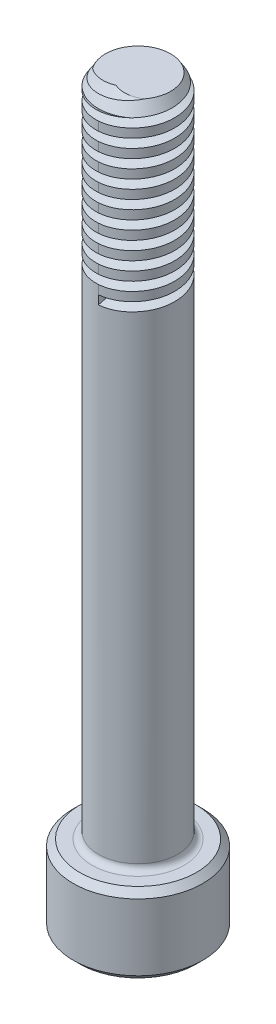
from build123d import *

# Parameters (mm, degrees)
CUT_SWEEP1_PITCH   = 0.635
CUT_EXTRUDE1_DEPTH = 1.2954
FILLET1_R          = 0.2286
FILLET2_R          = 0.396875794
CHAMFER2_SIZE      = 0.2286
CHAMFER3_SIZE      = 0.127


with BuildPart() as part:
    # Sketch1 → Revolve1 (revolve)
    with BuildSketch(Plane.XY, mode=Mode.PRIVATE) as revolve1_sk:
        Polygon((0, 0), (0, 26.6573), (1.4224, 26.6573), (1.4224, 2.8448), (2.3241, 2.8448), (2.3241, 0), align=None)
    revolve(revolve1_sk.sketch.rotate(Axis((0, 0, 0), (0, 1, 0)), 90), axis=Axis((0, 0, 0), (0, 1, 0)))

    # Cut-Sweep1: arcs per turn and ends read off the stored shape
    # Cut-Sweep1: the profile of Sketch3 profile screwed along a right-hand helix through 11 turns, 6 arcs to a turn; built about Z, then put on its axis
    cut_sweep1_z = Axis((0, 0, 0), (0, 0, 1))
    cut_sweep1_corners = [(1.4227, 0, -0.476175), (1.4227, 0, -0.793825), (0.78739873, 0, -0.635)]
    with BuildLine(mode=Mode.PRIVATE) as cut_sweep1_profile:
        Line(cut_sweep1_corners[0], cut_sweep1_corners[1])
        Line(cut_sweep1_corners[1], cut_sweep1_corners[2])
        Line(cut_sweep1_corners[2], cut_sweep1_corners[0])
    cut_sweep1_cap = Face(cut_sweep1_profile.wire())
    cut_sweep1_turn_angles = [0, 30, 60, 90, 120, 150, 180, 210, 240, 270, 300, 330, 360]
    cut_sweep1_turn_weights = [1, 0.8660254037844387, 1, 0.8660254037844387, 1, 0.8660254037844387, 1, 0.8660254037844387, 1, 0.8660254037844387, 1, 0.8660254037844387, 1]
    cut_sweep1_turn_rails = [Edge.make_bspline([Vector(p[0], p[1], 0).rotate(cut_sweep1_z, cut_sweep1_turn_angles[k]) / cut_sweep1_turn_weights[k] + Vector(0, 0, p[2] + CUT_SWEEP1_PITCH * cut_sweep1_turn_angles[k] / 360) for k in range(13)], [0, 0, 0, 1, 1, 2, 2, 3, 3, 4, 4, 5, 5, 6, 6, 6], 2, cut_sweep1_turn_weights) for p in cut_sweep1_corners]
    cut_sweep1_turn_sides = [Face.make_surface_from_curves(cut_sweep1_turn_rails[p[0]], cut_sweep1_turn_rails[p[1]]) for p in [(0, 1), (1, 2), (2, 0)]]
    cut_sweep1 = Plane(origin=(0, 26.6573, 0), x_dir=(0, 0, 1), z_dir=(0, -1, 0)) * Solid(Shell([*[p.moved(Location((0, 0, CUT_SWEEP1_PITCH * i))) for i in range(11) for p in cut_sweep1_turn_sides], cut_sweep1_cap, cut_sweep1_cap.rotate(cut_sweep1_z, 3960).moved(Location((0, 0, CUT_SWEEP1_PITCH * 3960 / 360)))]))
    add(cut_sweep1, mode=Mode.SUBTRACT)

    # Sketch4 → Cut-Extrude1 (cut)
    with BuildSketch(Plane(origin=(0, 0, 0), x_dir=(1, 0, 0), z_dir=(0, 1, 0))):
        Polygon((0, 1.378481503), (-1.1938, 0.689240751), (-1.1938, -0.689240751), (0, -1.378481503), (1.1938, -0.689240751), (1.1938, 0.689240751), align=None)
    extrude(amount=CUT_EXTRUDE1_DEPTH, mode=Mode.SUBTRACT)

    # Fillet1
    fillet1_edges = [part.edges().sort_by_distance(p)[0] for p in [
        (0, 2.8448, 1.4224),
    ]]
    fillet(fillet1_edges, radius=FILLET1_R)

    # Fillet2
    fillet2_edges = [part.edges().sort_by_distance(p)[0] for p in [
        (1.1938, 0.6477, -0.689240751),
        (0, 0.6477, -1.378481503),
        (-1.1938, 0.6477, -0.689240751),
        (-1.1938, 0.6477, 0.689240751),
        (0, 0.6477, 1.378481503),
        (1.1938, 0.6477, 0.689240751),
        (0.5969, 1.2954, -1.033861127),
        (-0.5969, 1.2954, -1.033861127),
        (-1.1938, 1.2954, 0),
        (-0.5969, 1.2954, 1.033861127),
        (0.5969, 1.2954, 1.033861127),
        (1.1938, 1.2954, 0),
    ]]
    fillet(fillet2_edges, radius=FILLET2_R)

    # Chamfer1: read off the stored shape, not the designer's step
    # Chamfer1 outline → Chamfer1 (revolve, cut)
    with BuildSketch(Plane.XY):
        Polygon((1.4224, 26.6573), (1.168399492, 26.6573), (1.4224, 26.245876279), align=None)
    revolve(axis=Axis((0, 0, 0), (0, 1, 0)), mode=Mode.SUBTRACT)

    # Chamfer2
    chamfer2_edges = [part.edges().sort_by_distance(p)[0] for p in [
        (0, 0, 2.3241),
        (0, 2.8448, 2.3241),
    ]]
    chamfer(chamfer2_edges, length=CHAMFER2_SIZE)

    # Chamfer3
    chamfer3_edges = [part.edges().sort_by_distance(p)[0] for p in [
        (0.5969, 0, -1.033861127),
        (-0.5969, 0, -1.033861127),
        (-1.1938, 0, 0),
        (-0.5969, 0, 1.033861127),
        (0.5969, 0, 1.033861127),
        (1.1938, 0, 0),
        (0, 0, -1.317084604),
        (1.140628726, 0, -0.658542302),
        (1.140628726, 0, 0.658542302),
        (0, 0, 1.317084604),
        (-1.140628726, 0, 0.658542302),
        (-1.140628726, 0, -0.658542302),
    ]]
    chamfer(chamfer3_edges, length=CHAMFER3_SIZE)


solid = part.part
